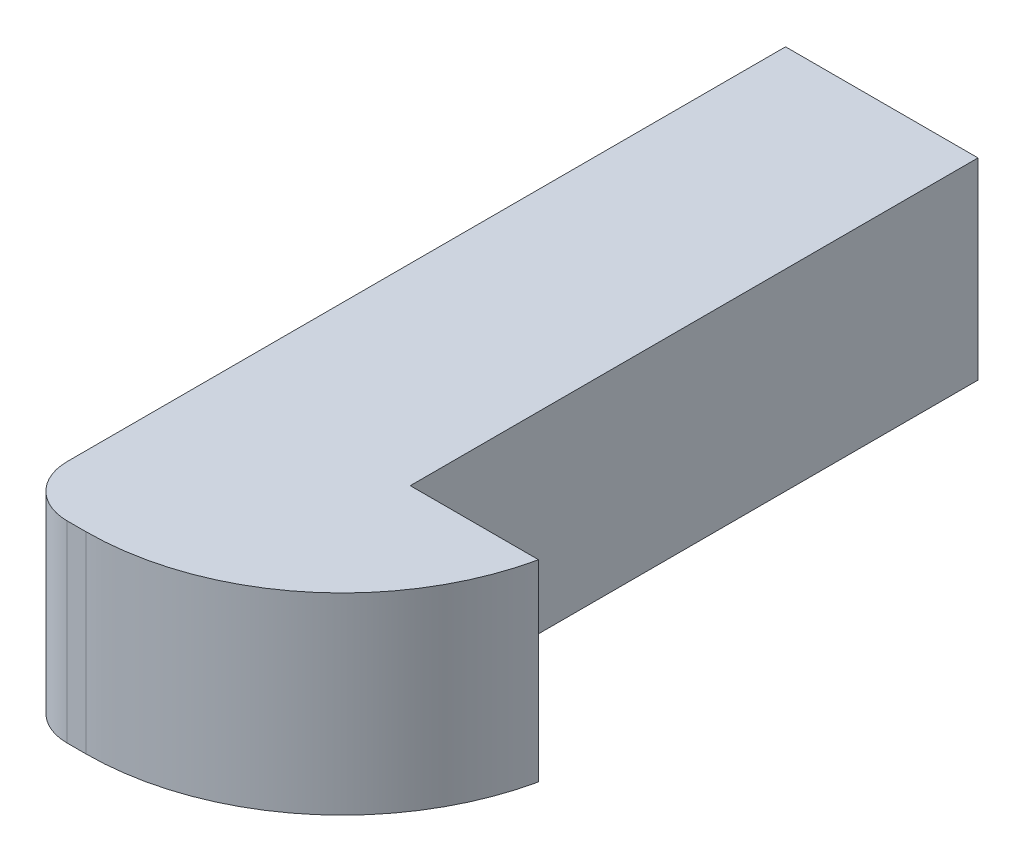
from build123d import *

# Parameters (mm, degrees)
SKETCH1_W                         = 9.525
SKETCH1_H                         = 9.525
EXTRUDE1_DEPTH                    = 38.1
F_1_4_20_TAPPED_HOLE1_D           = 5.1054
F_1_4_20_TAPPED_HOLE1_DEPTH       = 21.336
F_1_4_20_TAPPED_HOLE1_CBORE_D     = 6.35
F_1_4_20_TAPPED_HOLE1_CBORE_DEPTH = 14.986
F_1_4_20_TAPPED_HOLE1_TIP         = 1.533816902
SKETCH9_W                         = 10
SKETCH9_H                         = 9.525
EXTRUDE3_DEPTH                    = 6.35
FILLET2_R                         = 12.7
FILLET3_R                         = 2.54


with BuildPart() as part:
    # Sketch1 → Extrude1 (new body)
    with BuildSketch(Plane.XY):
        with Locations((-4.7625, 4.7625)):
            Rectangle(SKETCH1_W, SKETCH1_H)
    extrude(amount=EXTRUDE1_DEPTH)

    # 1/4-20 Tapped Hole1
    with Locations(Plane(origin=(-4.7625, 4.7625, 0), x_dir=(-1, 0, 0), z_dir=(0, 0, -1))):
        with Locations((0, 0)):
            CounterBoreHole(F_1_4_20_TAPPED_HOLE1_D / 2, F_1_4_20_TAPPED_HOLE1_CBORE_D / 2, F_1_4_20_TAPPED_HOLE1_CBORE_DEPTH, depth=F_1_4_20_TAPPED_HOLE1_DEPTH)
            with Locations((0, 0, -(F_1_4_20_TAPPED_HOLE1_DEPTH + F_1_4_20_TAPPED_HOLE1_TIP / 2))):  # 118° drill point
                Cone(0, F_1_4_20_TAPPED_HOLE1_D / 2, F_1_4_20_TAPPED_HOLE1_TIP, mode=Mode.SUBTRACT)

    # Sketch9 → Extrude3 (add)
    with BuildSketch(Plane(origin=(0, 0, 0), x_dir=(0, 0, -1), z_dir=(1, 0, 0))):
        with Locations((-33.1, 4.7625)):
            Rectangle(SKETCH9_W, SKETCH9_H)
    extrude(amount=EXTRUDE3_DEPTH)

    # Fillet2
    # the kernel refuses this fillet: 12.7 mm, written as the material it takes off along each edge
    with BuildSketch(Plane(origin=(6.35, -31.024184115, 38.1), x_dir=(-1, 0, 0), z_dir=(0, 1, 0))) as fillet2_piece_1:
        with BuildLine():
            CenterArc((12.409673646, -12.7), FILLET2_R, 90, 77.725329785)
            Line((0, -10), (-0.248193473, -9.946))
            ThreePointArc((-0.248193473, -9.946), (-0.254, -5), (-0.254, 0))
            Line((-0.254, 0), (0, 0.254))
            Line((0, 0.254), (12.409673646, 0.254))
            Line((12.409673646, 0.254), (12.409673646, 0))
        make_face()
    extrude(amount=71.57336823, mode=Mode.SUBTRACT)

    # Fillet3
    fillet3_edges = [part.edges().sort_by_distance(p)[0] for p in [
        (-9.525, 4.7625, 38.1),
    ]]
    fillet(fillet3_edges, radius=FILLET3_R)


solid = part.part
